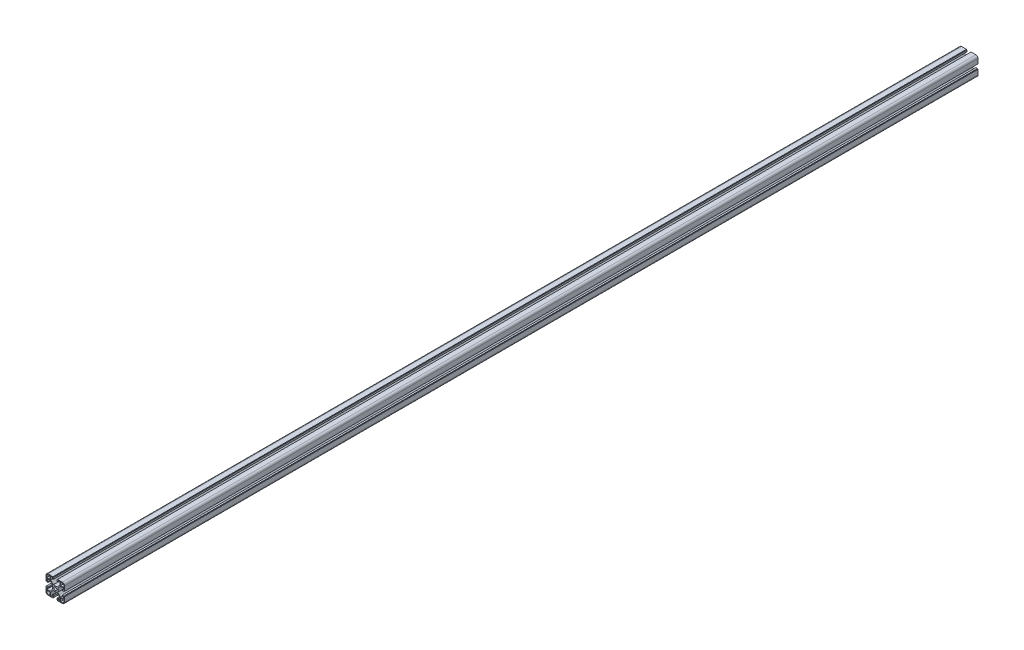
from build123d import *
from build123d.topology import SkipClean

# Parameters (mm, degrees)
BOSS_EXTRUDE1_DEPTH  = 1980
MIRROR3_COPY_1_DEPTH = 1980
MIRROR3_COPY_2_DEPTH = 1980


with BuildPart() as part:
    # Sketch1 → Boss-Extrude1 (new body)
    with BuildSketch(Plane.XY):
        with BuildLine():
            Line((3.4, 0), (5.5, 0))
            Line((5.5, 0), (5.5, 4))
            Line((5.5, 4), (11.69, 10.19))
            Line((11.69, 10.19), (18.2, 10.19))
            Line((18.2, 10.19), (18.2, 6.3))
            Line((18.2, 6.3), (15.5, 6.3))
            Line((15.5, 6.3), (15.5, 4))
            Line((15.5, 4), (19, 4))
            Line((19, 4), (19, 5))
            Line((19, 5), (20, 5))
            Line((20, 5), (20, 15.5))
            ThreePointArc((20, 15.5), (18.681980515, 18.681980515), (15.5, 20))
            Line((15.5, 20), (5, 20))
            Line((5, 20), (5, 19))
            Line((5, 19), (4, 19))
            Line((4, 19), (4, 15.5))
            Line((4, 15.5), (6.3, 15.5))
            Line((6.3, 15.5), (6.3, 18.2))
            Line((6.3, 18.2), (10.19, 18.2))
            Line((10.19, 18.2), (10.19, 11.69))
            Line((10.19, 11.69), (4, 5.5))
            Line((4, 5.5), (0, 5.5))
            Line((0, 5.5), (0, 3.4))
            ThreePointArc((0, 3.4), (2.404163056, 2.404163056), (3.4, 0))
        make_face()
        with BuildLine():
            Line((18.5, 11.69), (18.5, 15.5))
            ThreePointArc((18.5, 15.5), (17.621320344, 17.621320344), (15.5, 18.5))
            Line((15.5, 18.5), (11.69, 18.5))
            Line((11.69, 18.5), (11.69, 11.69))
            Line((11.69, 11.69), (18.5, 11.69))
        make_face(mode=Mode.SUBTRACT)
    boss_extrude1 = extrude(amount=BOSS_EXTRUDE1_DEPTH)

    # Mirror1: Boss-Extrude1 across plane
    add(boss_extrude1.mirror(Plane.ZX))

    # Mirror2: Boss-Extrude1 across plane
    add(boss_extrude1.mirror(Plane(origin=(0, 0, 0), x_dir=(0, 0, 1), z_dir=(1, 0, 0))))

    # Mirror3 copy 1 sketch → Mirror3 copy 1 (add)
    with BuildSketch(Plane(origin=(0, 0, 0), x_dir=(-1, 0, 0), z_dir=(0, 0, 1))):
        with BuildLine():
            Line((3.4, 0), (5.5, 0))
            Line((5.5, 0), (5.5, 4))
            Line((5.5, 4), (11.69, 10.19))
            Line((11.69, 10.19), (18.2, 10.19))
            Line((18.2, 10.19), (18.2, 6.3))
            Line((18.2, 6.3), (15.5, 6.3))
            Line((15.5, 6.3), (15.5, 4))
            Line((15.5, 4), (19, 4))
            Line((19, 4), (19, 5))
            Line((19, 5), (20, 5))
            Line((20, 5), (20, 15.5))
            ThreePointArc((20, 15.5), (18.681980515, 18.681980515), (15.5, 20))
            Line((15.5, 20), (5, 20))
            Line((5, 20), (5, 19))
            Line((5, 19), (4, 19))
            Line((4, 19), (4, 15.5))
            Line((4, 15.5), (6.3, 15.5))
            Line((6.3, 15.5), (6.3, 18.2))
            Line((6.3, 18.2), (10.19, 18.2))
            Line((10.19, 18.2), (10.19, 11.69))
            Line((10.19, 11.69), (4, 5.5))
            Line((4, 5.5), (0, 5.5))
            Line((0, 5.5), (0, 3.4))
            ThreePointArc((0, 3.4), (2.404163056, 2.404163056), (3.4, 0))
        make_face()
        with BuildLine():
            Line((18.5, 11.69), (18.5, 15.5))
            ThreePointArc((18.5, 15.5), (17.621320344, 17.621320344), (15.5, 18.5))
            Line((15.5, 18.5), (11.69, 18.5))
            Line((11.69, 18.5), (11.69, 11.69))
            Line((11.69, 11.69), (18.5, 11.69))
        make_face(mode=Mode.SUBTRACT)
    extrude(amount=MIRROR3_COPY_1_DEPTH)

    # Mirror3 copy 2 sketch → Mirror3 copy 2 (add)
    with SkipClean():  # the faces are left unmerged after this step: merging them gives an invalid solid
        with BuildSketch(Plane.XY):
            with BuildLine():
                Line((3.4, 0), (5.5, 0))
                Line((5.5, 0), (5.5, -4))
                Line((5.5, -4), (11.69, -10.19))
                Line((11.69, -10.19), (18.2, -10.19))
                Line((18.2, -10.19), (18.2, -6.3))
                Line((18.2, -6.3), (15.5, -6.3))
                Line((15.5, -6.3), (15.5, -4))
                Line((15.5, -4), (19, -4))
                Line((19, -4), (19, -5))
                Line((19, -5), (20, -5))
                Line((20, -5), (20, -15.5))
                ThreePointArc((20, -15.5), (18.681980515, -18.681980515), (15.5, -20))
                Line((15.5, -20), (5, -20))
                Line((5, -20), (5, -19))
                Line((5, -19), (4, -19))
                Line((4, -19), (4, -15.5))
                Line((4, -15.5), (6.3, -15.5))
                Line((6.3, -15.5), (6.3, -18.2))
                Line((6.3, -18.2), (10.19, -18.2))
                Line((10.19, -18.2), (10.19, -11.69))
                Line((10.19, -11.69), (4, -5.5))
                Line((4, -5.5), (0, -5.5))
                Line((0, -5.5), (0, -3.4))
                ThreePointArc((0, -3.4), (2.404163056, -2.404163056), (3.4, 0))
            make_face()
            with BuildLine():
                Line((18.5, -11.69), (18.5, -15.5))
                ThreePointArc((18.5, -15.5), (17.621320344, -17.621320344), (15.5, -18.5))
                Line((15.5, -18.5), (11.69, -18.5))
                Line((11.69, -18.5), (11.69, -11.69))
                Line((11.69, -11.69), (18.5, -11.69))
            make_face(mode=Mode.SUBTRACT)
        extrude(amount=MIRROR3_COPY_2_DEPTH)


solid = part.part
